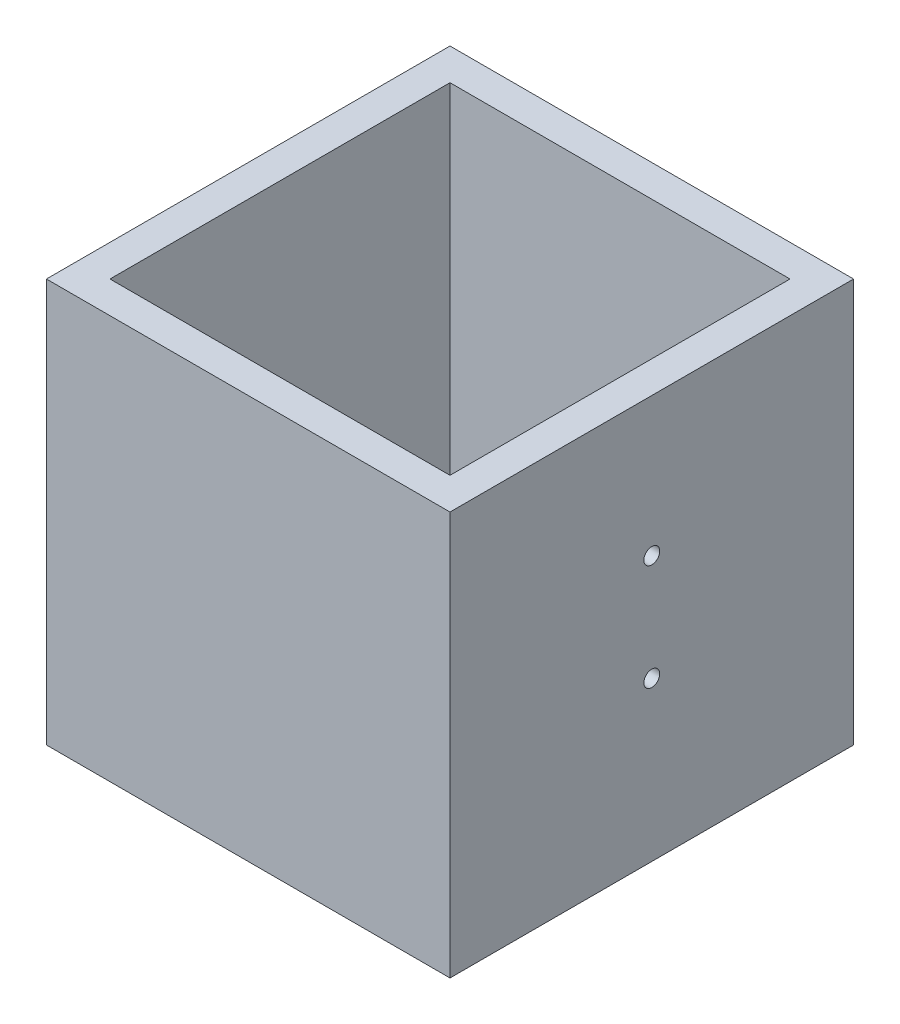
from build123d import *

# Parameters (mm, degrees)
SKETCH1_W           = 25.4
SKETCH1_H           = 25.4
BOSS_EXTRUDE1_DEPTH = 25.4
SHELL1_T            = -2
SKETCH2_R           = 0.5
CUT_EXTRUDE1_DEPTH  = 6.4
SKETCH3_R           = 0.5
CUT_EXTRUDE2_DEPTH  = 6.4
SHELL2_START        = 1.5
SHELL2_OUTLINE_W    = 0.5
SHELL2_OUTLINE_H    = 22.4
SHELL2_DEPTH        = 22.4


# Read off the part's stored shape, not the designer's step: Shell2
with BuildPart() as part:
    # Sketch1 → Boss-Extrude1 (new body)
    with BuildSketch(Plane(origin=(0, 0, 0), x_dir=(1, 0, 0), z_dir=(0, 1, 0))):
        Rectangle(SKETCH1_W, SKETCH1_H)
    extrude(amount=BOSS_EXTRUDE1_DEPTH)

    # Shell1
    shell1_openings = [part.faces().sort_by_distance(p)[0] for p in [
        (0, 25.4, 0),
    ]]
    offset(amount=SHELL1_T, openings=shell1_openings, kind=Kind.INTERSECTION)

    # Sketch2 → Cut-Extrude1 (cut)
    with BuildSketch(Plane(origin=(12.7, 0, 0), x_dir=(0, 0, -1), z_dir=(1, 0, 0))):
        with Locations((0, 9.984928122)):
            Circle(SKETCH2_R)
    extrude(amount=-CUT_EXTRUDE1_DEPTH, mode=Mode.SUBTRACT)

    # Sketch3 → Cut-Extrude2 (cut)
    with BuildSketch(Plane(origin=(12.7, 0, 0), x_dir=(0, 0, -1), z_dir=(1, 0, 0))):
        with Locations((0, 16.669636536)):
            Circle(SKETCH3_R)
    extrude(amount=-CUT_EXTRUDE2_DEPTH, mode=Mode.SUBTRACT)

    # Shell2 outline → Shell2 (cut)
    with BuildSketch(Plane(origin=(0, 0, 0), x_dir=(1, 0, 0), z_dir=(0, 1, 0)).offset(SHELL2_START)):
        with Locations((-12.45, 0)):
            Rectangle(SHELL2_OUTLINE_W, SHELL2_OUTLINE_H)
    extrude(amount=SHELL2_DEPTH, mode=Mode.SUBTRACT)


solid = part.part
